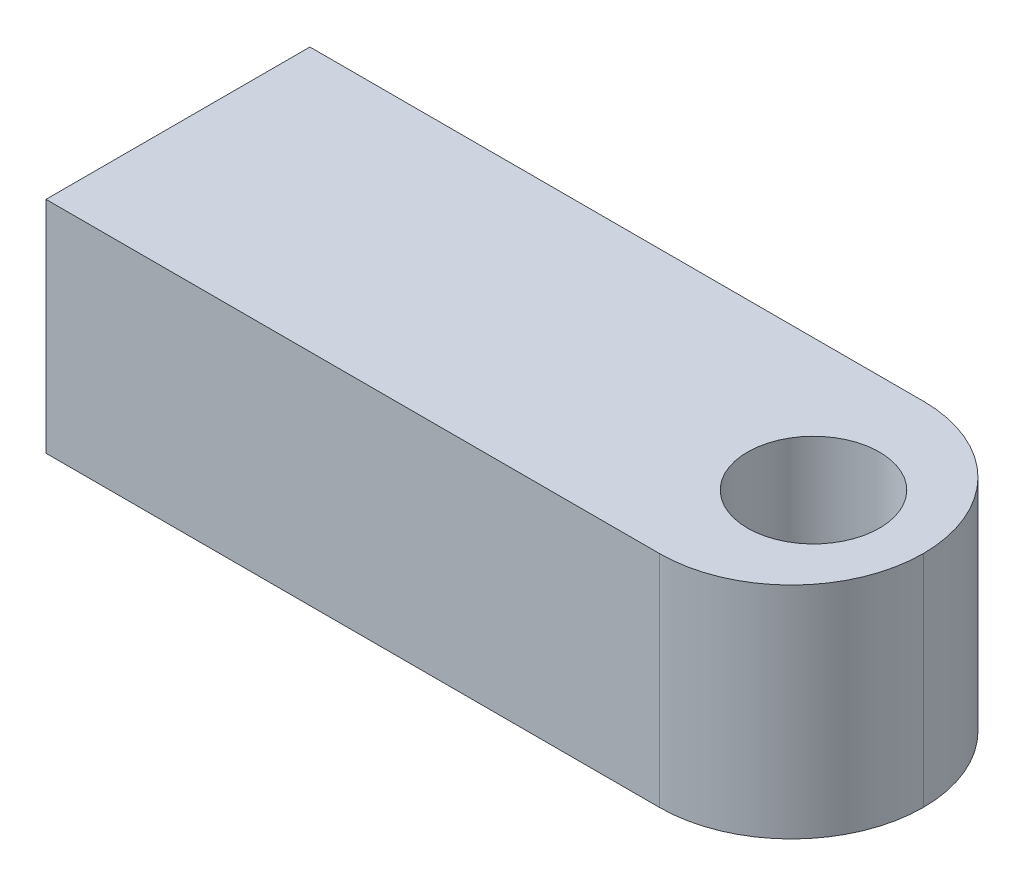
from build123d import *

# Parameters (mm, degrees)
SKETCH1_W           = 33.895402138
SKETCH1_H           = 12
SKETCH1_R           = 3
BOSS_EXTRUDE1_DEPTH = 10
FILLET1_R           = 6


with BuildPart() as part:
    # Sketch1 → Boss-Extrude1 (new body)
    with BuildSketch(Plane(origin=(0, 0, 0), x_dir=(1, 0, 0), z_dir=(0, 1, 0))):
        with Locations((16.947701069, 0)):
            Rectangle(SKETCH1_W, SKETCH1_H)
        with Locations(Location((28.9, 0, 0), (0, 0, 270))):
            Circle(SKETCH1_R, mode=Mode.SUBTRACT)
    extrude(amount=BOSS_EXTRUDE1_DEPTH)

    # Fillet1
    fillet1_edges = [part.edges().sort_by_distance(p)[0] for p in [
        (33.895402138, 5, -6),
        (33.895402138, 5, 6),
    ]]
    fillet(fillet1_edges, radius=FILLET1_R - 0.0001)  # a hair under: the kernel refuses the full size


solid = part.part
